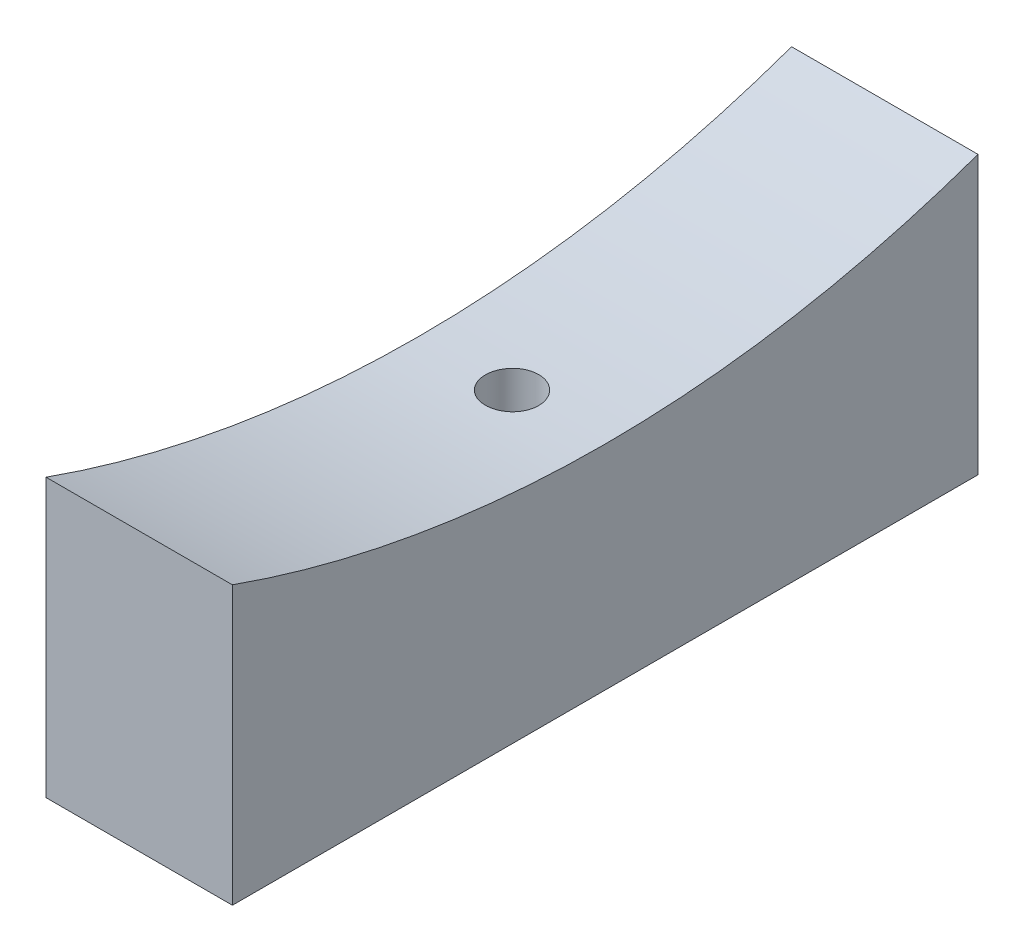
from build123d import *

# Parameters (mm, degrees)
BOSS_EXTRU_1_DEPTH      = 21
ENL_V_MAT_EXTRU_1_REACH = 58.415
ESQUISSE2_R             = 3


with BuildPart() as part:
    # Esquisse1 → Boss.-Extru.1 (new body)
    with BuildSketch(Plane(origin=(0, 0, 0), x_dir=(0, 0, -1), z_dir=(1, 0, 0))):
        with BuildLine():
            Line((-42, -117.732748205), (-42, -149))
            Line((-42, -149), (42, -149))
            Line((42, -149), (42, -117.732748205))
            ThreePointArc((42, -117.732748205), (0, -125), (-42, -117.732748205))
        make_face()
    extrude(amount=BOSS_EXTRU_1_DEPTH)

    # Esquisse2 → Enlèv. mat.-Extru.1 (cut, up to next)
    with BuildSketch(Plane.XZ.offset(149), mode=Mode.PRIVATE) as enl_v_mat_extru_1_sk1:
        with Locations((10.5, 0)):
            Circle(ESQUISSE2_R)
    enl_v_mat_extru_1_tool1 = extrude(enl_v_mat_extru_1_sk1.sketch, amount=-ENL_V_MAT_EXTRU_1_REACH, mode=Mode.PRIVATE) & part.part
    add(enl_v_mat_extru_1_tool1.solids().sort_by_distance((10.5, -149, 0))[0], mode=Mode.SUBTRACT)


solid = part.part
